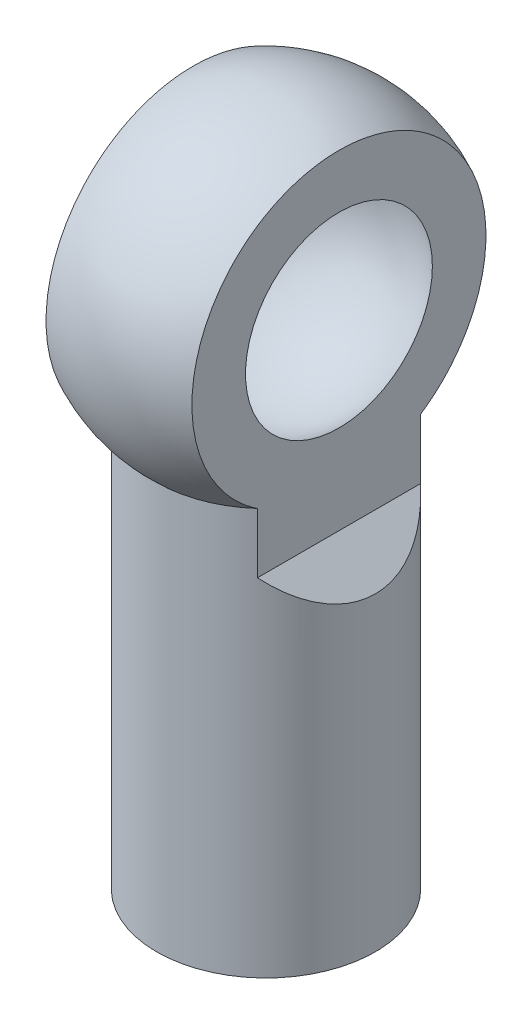
from build123d import *

# Parameters (mm, degrees)
SKETCH1_R           = 3
SKETCH1_R_2         = 1.5
BOSS_EXTRUDE1_DEPTH = 11.5
SKETCH3_W           = 9
SKETCH3_H           = 9.5
CUT_EXTRUDE1_DEPTH  = 10
SKETCH4_W           = 9
SKETCH4_H           = 9.5
CUT_EXTRUDE2_DEPTH  = 10
SKETCH5_W           = 2
SKETCH5_H           = 4.472135954
CUT_EXTRUDE3_DEPTH  = 10
SKETCH6_W           = 2
SKETCH6_H           = 4.472135954
CUT_EXTRUDE4_DEPTH  = 10


# Read off the part's stored shape, not the designer's step: Revolve13
with BuildPart() as part:
    # Sketch1 → Boss-Extrude1 (new body)
    with BuildSketch(Plane(origin=(0, 0, 0), x_dir=(1, 0, 0), z_dir=(0, 1, 0))):
        with Locations(Location((0, 0, 0), (0, 0, 270))):
            Circle(SKETCH1_R)
        with Locations(Location((0, 0, 0), (0, 0, 270))):
            Circle(SKETCH1_R_2, mode=Mode.SUBTRACT)
    extrude(amount=BOSS_EXTRUDE1_DEPTH)

    # Revolve13 outline → Revolve13 (revolve)
    with BuildSketch(Plane.XY):
        with BuildLine():
            ThreePointArc((2.999999997, 11.145898031), (4.203775616, 16.105699402), (0, 19))
            Line((0, 19), (0, 17.75))
            ThreePointArc((0, 17.75), (3.25, 14.5), (0, 11.25))
            Line((0, 11.25), (0, 10))
            ThreePointArc((0, 10), (0.760958906, 10.064806482), (1.500000004, 10.257359314))
            Line((1.500000004, 10.257359314), (1.5, 11.5))
            Line((1.5, 11.5), (3, 11.5))
            Line((3, 11.5), (2.999999997, 11.145898031))
        make_face()
    revolve(axis=Axis((0, 0, 0), (0, 1, 0)))

    # Sketch3 → Cut-Extrude1 (cut)
    with BuildSketch(Plane(origin=(2, 0, 0), x_dir=(0, 0, -1), z_dir=(1, 0, 0))):
        with Locations((0, 14.25)):
            Rectangle(SKETCH3_W, SKETCH3_H)
    extrude(amount=CUT_EXTRUDE1_DEPTH, mode=Mode.SUBTRACT)

    # Sketch4 → Cut-Extrude2 (cut)
    with BuildSketch(Plane(origin=(-2, 0, 0), x_dir=(0, 0, -1), z_dir=(1, 0, 0))):
        with Locations((0, 14.25)):
            Rectangle(SKETCH4_W, SKETCH4_H)
    extrude(amount=-CUT_EXTRUDE2_DEPTH, mode=Mode.SUBTRACT)

    # Sketch5 → Cut-Extrude3 (cut)
    with BuildSketch(Plane(origin=(5.75, 5.75, 0), x_dir=(0.7071067811865477, -0.7071067811865475, 0), z_dir=(0.7071067811865475, 0.7071067811865477, 0))):
        with Locations((-4.303300859, 0)):
            Rectangle(SKETCH5_W, SKETCH5_H)
    extrude(amount=CUT_EXTRUDE3_DEPTH, mode=Mode.SUBTRACT)

    # Sketch6 → Cut-Extrude4 (cut)
    with BuildSketch(Plane(origin=(-5.75, 5.75, 0), x_dir=(0.7071067811865476, 0.7071067811865476, 0), z_dir=(-0.7071067811865476, 0.7071067811865476, 0))):
        with Locations((4.303300859, 0)):
            Rectangle(SKETCH6_W, SKETCH6_H)
    extrude(amount=CUT_EXTRUDE4_DEPTH, mode=Mode.SUBTRACT)


solid = part.part
